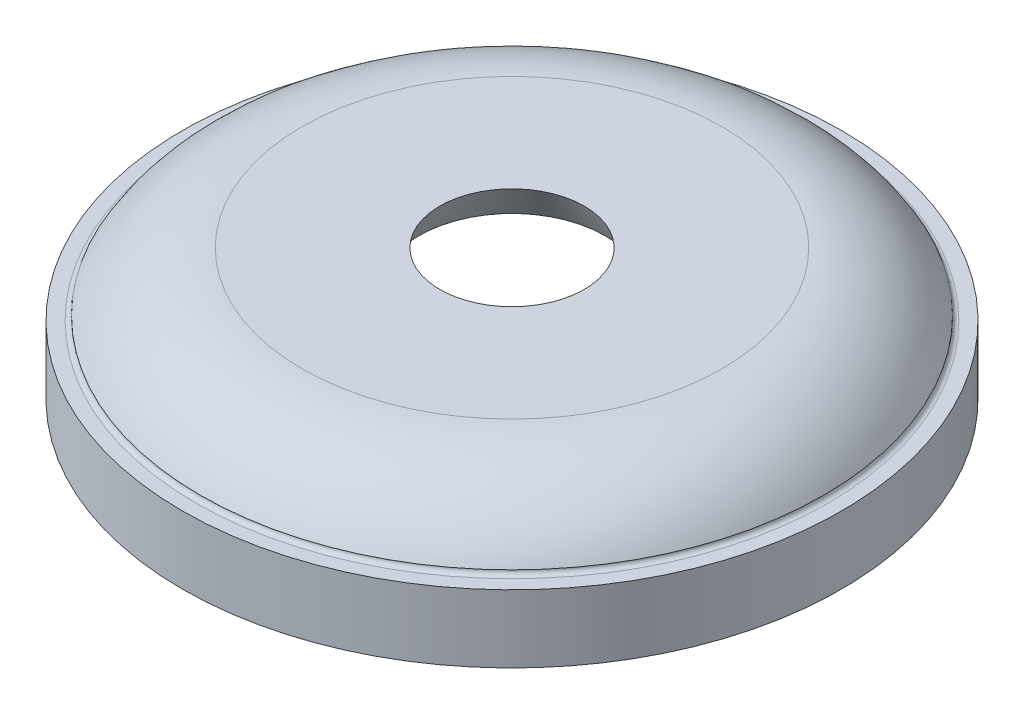
from build123d import *

# Parameters (mm, degrees)
RACCORDO1_R = 1


with BuildPart() as part:
    # Schizzo1 → Rivoluzione1 (revolve)
    with BuildSketch(Plane.XY, mode=Mode.PRIVATE) as rivoluzione1_sk:
        with BuildLine():
            Line((-71, 0), (-73, 0))
            Line((-73, 0), (-73, 15))
            Line((-73, 15), (-69, 15))
            Line((-69, 15), (-69, 16))
            ThreePointArc((-69, 16), (-59.483339502, 25.516660498), (-46.483339502, 29))
            Line((-46.483339502, 29), (-16, 29))
            Line((-16, 29), (-20.618802154, 21))
            Line((-20.618802154, 21), (-46.483339502, 21))
            ThreePointArc((-46.483339502, 21), (-59.726832166, 16.773781497), (-68.074288586, 5.657532485))
            Line((-68.074288586, 5.657532485), (-69, 3))
            Line((-69, 3), (-71, 3))
            Line((-71, 3), (-71, 0))
        make_face()
    revolve(rivoluzione1_sk.sketch.rotate(Axis((0, 0, 0), (0, 1, 0)), 270), axis=Axis((0, 0, 0), (0, 1, 0)))

    # Raccordo1
    raccordo1_edges = [part.edges().sort_by_distance(p)[0] for p in [
        (0, 15, 69),
    ]]
    fillet(raccordo1_edges, radius=RACCORDO1_R - 0.0001)  # a hair under: the kernel refuses the full size


solid = part.part
